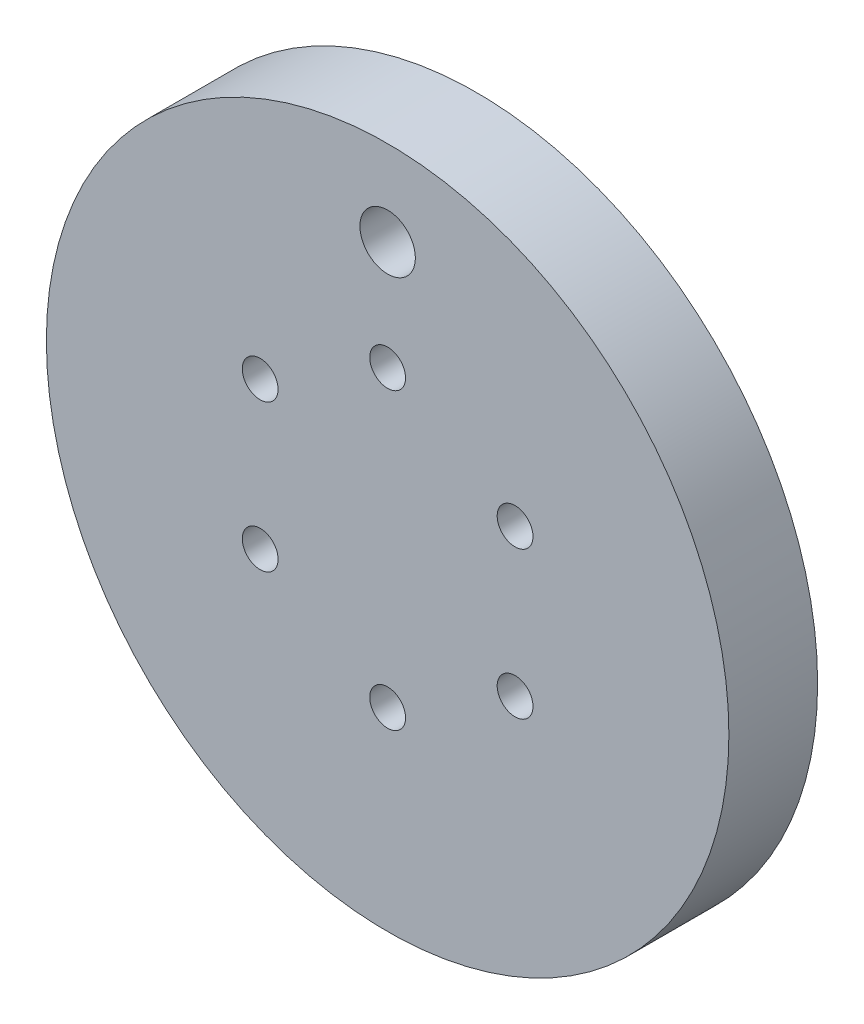
from build123d import *

# Parameters (mm, degrees)
SKETCH_1_R          = 40
SKETCH_1_R_2        = 2.1
EXTRUDE_1_DEPTH     = 10.4
SKETCH_2_R          = 3.25
CUT_EXTRUDE_1_DEPTH = 58.516606298


with BuildPart() as part:
    # 草图1 → 凸台-拉伸1 (new body)
    with BuildSketch(Plane.XY):
        Circle(SKETCH_1_R)
        with Locations((0, 17.25)):
            Circle(SKETCH_1_R_2, mode=Mode.SUBTRACT)
        with Locations((14.938938215, 8.625)):
            Circle(SKETCH_1_R_2, mode=Mode.SUBTRACT)
        with Locations((14.938938215, -8.625)):
            Circle(SKETCH_1_R_2, mode=Mode.SUBTRACT)
        with Locations((0, -17.25)):
            Circle(SKETCH_1_R_2, mode=Mode.SUBTRACT)
        with Locations((-14.938938215, -8.625)):
            Circle(SKETCH_1_R_2, mode=Mode.SUBTRACT)
        with Locations((-14.938938215, 8.625)):
            Circle(SKETCH_1_R_2, mode=Mode.SUBTRACT)
    extrude(amount=EXTRUDE_1_DEPTH)

    # 草图2 → 切除-拉伸1 (cut, through all)
    with BuildSketch(Plane.XY.offset(10.4)):
        with Locations((0, 30)):
            Circle(SKETCH_2_R)
    extrude(amount=-CUT_EXTRUDE_1_DEPTH, mode=Mode.SUBTRACT)


solid = part.part
